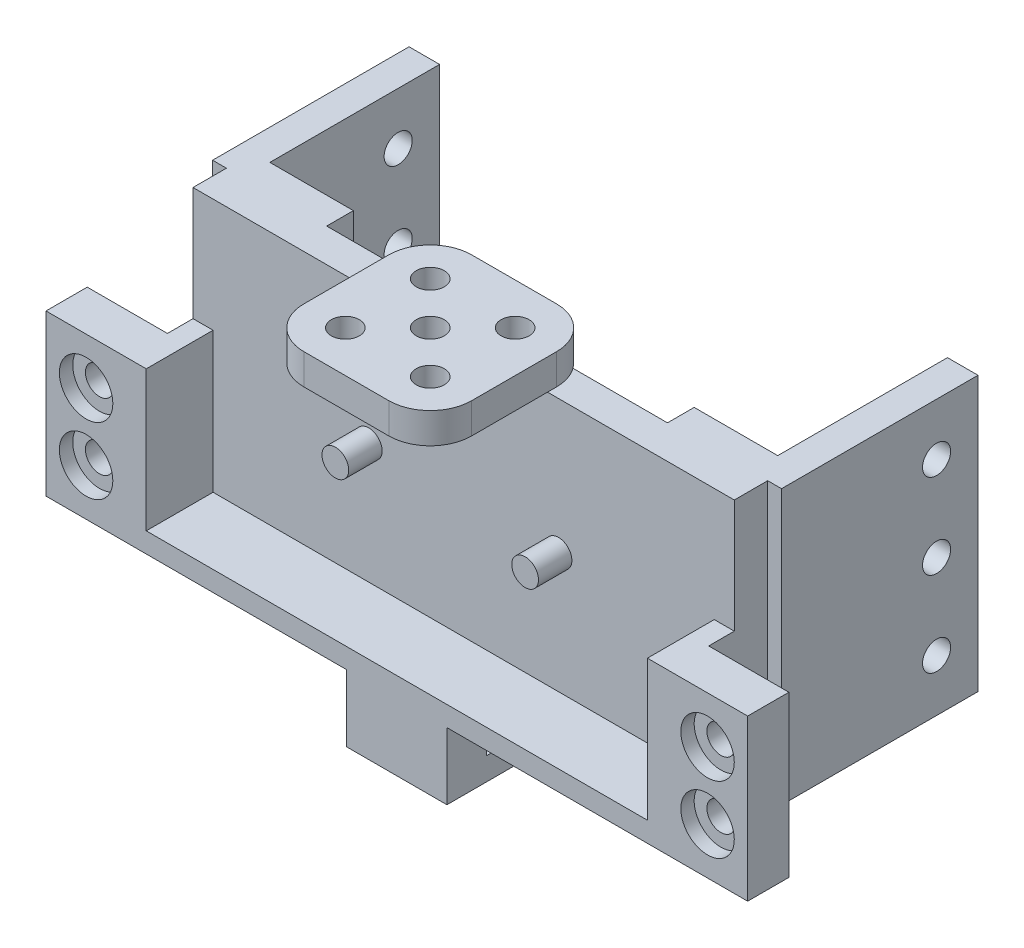
from build123d import *

# Parameters (mm, degrees)
SKETCH1_W                = 75
SKETCH1_H                = 35
BOSS_EXTRUDE1_DEPTH      = 5
SKETCH2_R                = 2
BOSS_EXTRUDE2_DEPTH      = 10
SKETCH3_W                = 75
SKETCH3_H                = 35
BOSS_EXTRUDE3_DEPTH      = 15
CUT_EXTRUDE2_DEPTH       = 10
SKETCH8_W                = 12.55
SKETCH8_H                = 5
SKETCH8_H_2              = 2.55
BOSS_EXTRUDE6_DEPTH      = 4.57
SKETCH9_R                = 2.1
CUT_EXTRUDE3_DEPTH       = 4.57
SKETCH14_W               = 3
SKETCH14_H               = 10
CUT_EXTRUDE5_DEPTH       = 17
SKETCH15_R               = 2.75
CUT_EXTRUDE6_DEPTH       = 1.5
FILLET1_R                = 1
CUT_EXTRUDE7_START       = -5
SKETCH19_R               = 2
CUT_EXTRUDE7_DEPTH       = 5
SKETCH20_W               = 6.17
SKETCH20_H               = 24
BOSS_EXTRUDE7_DEPTH      = 12
SKETCH21_W               = 6.17
SKETCH21_H               = 24
BOSS_EXTRUDE8_DEPTH      = 12
SKETCH24_R               = 2.1
CUT_EXTRUDE8_DEPTH       = 60.774520492
SKETCH25_R               = 4
CUT_EXTRUDE9_DEPTH       = 2
BOSS_EXTRUDE10_DEPTH     = 41
CUT_EXTRUDE11_DEPTH      = 99.402819573
CUT_EXTRUDE11_DEPTH_BACK = 99.402819573
SKETCH30_R               = 2.1
FILLET2_R                = 6.2
SKETCH31_W               = 15
SKETCH31_H               = 15
BOSS_EXTRUDE11_DEPTH     = 10
SKETCH32_W               = 5
SKETCH32_H               = 12
CUT_EXTRUDE12_DEPTH      = 10
SKETCH34_W               = 3.2
SKETCH34_H               = 3.2
CUT_EXTRUDE13_DEPTH      = 28
CUT_EXTRUDE14_START      = -5
SKETCH35_R               = 2
CUT_EXTRUDE14_DEPTH      = 5


with BuildPart() as part:
    # Sketch1 → Boss-Extrude1 (new body)
    with BuildSketch(Plane.XY):
        Rectangle(SKETCH1_W, SKETCH1_H)
    extrude(amount=BOSS_EXTRUDE1_DEPTH)

    # Sketch2 → Boss-Extrude2 (add)
    with BuildSketch(Plane.XY.offset(5)):
        with Locations(Location((-14.2, 0.5, 0), (0, 0, 180))):
            Circle(SKETCH2_R)
        with Locations(Location((14.2, 0.5, 0), (0, 0, 180))):
            Circle(SKETCH2_R)
    extrude(amount=BOSS_EXTRUDE2_DEPTH)

    # Sketch3 → Boss-Extrude3 (add)
    with BuildSketch(Plane(origin=(0, 0, 0), x_dir=(-1, 0, 0), z_dir=(0, 0, -1))):
        Polygon((40.5, 20.5), (-37.5, 20.5), (-40.5, 20.5), (-40.5, -20.5), (40.5, -20.5), (40.5, -17.5), align=None)
        Rectangle(SKETCH3_W, SKETCH3_H, mode=Mode.SUBTRACT)
    extrude(amount=-BOSS_EXTRUDE3_DEPTH)

    # Sketch4 → Cut-Extrude2 (cut)
    with BuildSketch(Plane(origin=(0, 20.5, 0), x_dir=(1, 0, 0), z_dir=(0, 1, 0))):
        Polygon((-37.5, -5), (-37.5, -12.5), (-37.5, -14), (-37.5, -15), (37.5, -15), (37.5, -14), (37.5, -12.5), (37.5, -5), align=None)
    extrude(amount=-CUT_EXTRUDE2_DEPTH, mode=Mode.SUBTRACT)

    # Sketch8 → Boss-Extrude6 (add)
    with BuildSketch(Plane(origin=(0, 20.5, 0), x_dir=(1, 0, 0), z_dir=(0, 1, 0))):
        Polygon((0, -15), (0, -5), (-12.55, -5), (-12.55, -22.55), (0, -22.55), align=None)
        Polygon((12.55, -5), (0, -5), (0, -15), (0, -22.55), (12.55, -22.55), align=None)
        with Locations((-6.275, -2.5)):
            Rectangle(SKETCH8_W, SKETCH8_H)
        with Locations((-6.275, 1.275)):
            Rectangle(SKETCH8_W, SKETCH8_H_2)
        with Locations((6.275, 1.275)):
            Rectangle(SKETCH8_W, SKETCH8_H_2)
        with Locations((6.275, -2.5)):
            Rectangle(SKETCH8_W, SKETCH8_H)
    extrude(amount=BOSS_EXTRUDE6_DEPTH)

    # Sketch9 → Cut-Extrude3 (cut)
    with BuildSketch(Plane(origin=(0, 25.07, 0), x_dir=(1, 0, 0), z_dir=(0, 1, 0))):
        with Locations(Location((0, -10, 0), (0, 0, 270))):
            Circle(SKETCH9_R)
        with Locations(Location((-6.349818895, -3.650181105, 0), (0, 0, 270))):
            Circle(SKETCH9_R)
        with Locations(Location((6.349818895, -3.650181105, 0), (0, 0, 270))):
            Circle(SKETCH9_R)
        with Locations(Location((6.349818895, -16.349818895, 0), (0, 0, 270))):
            Circle(SKETCH9_R)
        with Locations(Location((-6.349818895, -16.349818895, 0), (0, 0, 270))):
            Circle(SKETCH9_R)
    extrude(amount=-CUT_EXTRUDE3_DEPTH, mode=Mode.SUBTRACT)

    # Sketch14 → Cut-Extrude5 (cut)
    with BuildSketch(Plane(origin=(0, 20.5, 0), x_dir=(1, 0, 0), z_dir=(0, 1, 0))):
        with Locations((-39, -10)):
            Rectangle(SKETCH14_W, SKETCH14_H)
        with Locations((39, -10)):
            Rectangle(SKETCH14_W, SKETCH14_H)
    extrude(amount=-CUT_EXTRUDE5_DEPTH, mode=Mode.SUBTRACT)

    # Sketch15 → Cut-Extrude6 (cut)
    with BuildSketch(Plane(origin=(0, 20.5, 0), x_dir=(1, 0, 0), z_dir=(0, 1, 0))):
        with Locations((-6.349818895, -3.650181105)):
            Circle(SKETCH15_R)
        with Locations((6.349818895, -3.650181105)):
            Circle(SKETCH15_R)
    extrude(amount=-CUT_EXTRUDE6_DEPTH, mode=Mode.SUBTRACT)

    # Fillet1
    fillet1_edges = [part.edges().sort_by_distance(p)[0] for p in [
        (-8.745750645, 19.75, 5),
        (-3.953887145, 19.75, 5),
        (3.953887145, 19.75, 5),
        (8.745750645, 19.75, 5),
    ]]
    fillet(fillet1_edges, radius=FILLET1_R)

    # Sketch19 → Cut-Extrude7 (cut)
    with BuildSketch(Plane.XY.offset(15).offset(CUT_EXTRUDE7_START)):
        with Locations(Location((-14.2, 0.5, 0), (0, 0, 180))):
            Circle(SKETCH19_R)
    extrude(amount=CUT_EXTRUDE7_DEPTH, mode=Mode.SUBTRACT)

    # Sketch20 → Boss-Extrude7 (add)
    with BuildSketch(Plane(origin=(40.5, 0, 0), x_dir=(0, 0, -1), z_dir=(1, 0, 0))):
        with Locations((-11.915, -8.5)):
            Rectangle(SKETCH20_W, SKETCH20_H)
    extrude(amount=BOSS_EXTRUDE7_DEPTH)

    # Sketch21 → Boss-Extrude8 (add)
    with BuildSketch(Plane.ZY.offset(40.5)):
        with Locations((11.915, -8.5)):
            Rectangle(SKETCH21_W, SKETCH21_H)
    extrude(amount=BOSS_EXTRUDE8_DEPTH)

    # Sketch24 → Cut-Extrude8 (cut, through all)
    with BuildSketch(Plane(origin=(0, 0, 8.83), x_dir=(-1, 0, 0), z_dir=(0, 0, -1))):
        with Locations(Location((-46.5, -3.5, 0), (0, 0, 90))):
            Circle(SKETCH24_R)
        with Locations(Location((-46.5, -13.5, 0), (0, 0, 90))):
            Circle(SKETCH24_R)
        with Locations(Location((46.5, -3.5, 0), (0, 0, 90))):
            Circle(SKETCH24_R)
        with Locations(Location((46.5, -13.5, 0), (0, 0, 90))):
            Circle(SKETCH24_R)
    extrude(amount=-CUT_EXTRUDE8_DEPTH, mode=Mode.SUBTRACT)

    # Sketch25 → Cut-Extrude9 (cut)
    with BuildSketch(Plane.XY.offset(15)):
        with Locations((-46.5, -3.5)):
            Circle(SKETCH25_R)
        with Locations((-46.5, -13.5)):
            Circle(SKETCH25_R)
        with Locations((46.5, -13.5)):
            Circle(SKETCH25_R)
        with Locations((46.5, -3.5)):
            Circle(SKETCH25_R)
    extrude(amount=-CUT_EXTRUDE9_DEPTH, mode=Mode.SUBTRACT)

    # Sketch28 → Boss-Extrude10 (add)
    with BuildSketch(Plane.XZ.offset(20.5)):
        Polygon((-25.5, 0), (-42.57, 0), (-42.57, -29.4), (-38, -29.4), (-38, -4), (-25.5, -4), align=None)
        Polygon((25.5, 0), (42.57, 0), (42.57, -29.4), (38, -29.4), (38, -4), (25.5, -4), align=None)
    extrude(amount=-BOSS_EXTRUDE10_DEPTH)

    # Sketch30 → Cut-Extrude11 (cut, two sides: drawn at the far end of the back side and taken through both)
    with BuildSketch(Plane(origin=(-38, 0, 0), x_dir=(0, 0, -1), z_dir=(1, 0, 0)).offset(-CUT_EXTRUDE11_DEPTH_BACK)):
        with Locations(Location((23.2, 0, 0), (0, 0, 180))):
            Circle(SKETCH30_R)
        with Locations(Location((23.2, 12.7, 0), (0, 0, 180))):
            Circle(SKETCH30_R)
        with Locations(Location((23.2, -12.7, 0), (0, 0, 180))):
            Circle(SKETCH30_R)
    extrude(amount=CUT_EXTRUDE11_DEPTH + CUT_EXTRUDE11_DEPTH_BACK, mode=Mode.SUBTRACT)

    # Fillet2
    # the kernel refuses this fillet: 6.2 mm, written as the material it takes off along each edge
    with BuildSketch(Plane(origin=(12.55, 5, 22.55), x_dir=(0, 0, -1), z_dir=(0, 1, 0))) as fillet2_piece_1:
        with BuildLine():
            CenterArc((FILLET2_R, FILLET2_R), FILLET2_R, 180, 90)
            Line((0, FILLET2_R), (0, 0))
            Line((0, 0), (FILLET2_R, 0))
        make_face()
    extrude(amount=35.57, mode=Mode.SUBTRACT)
    with BuildSketch(Plane(origin=(12.55, 20.5, -2.55), x_dir=(0, 0, 1), z_dir=(0, 1, 0))) as fillet2_piece_2:
        with BuildLine():
            CenterArc((FILLET2_R, -FILLET2_R), FILLET2_R, 90, 90)
            Line((0, -FILLET2_R), (0, 0))
            Line((0, 0), (FILLET2_R, 0))
        make_face()
    extrude(amount=20.07, mode=Mode.SUBTRACT)
    with BuildSketch(Plane(origin=(-12.55, 20.5, -2.55), x_dir=(0, 0, 1), z_dir=(0, 1, 0))) as fillet2_piece_3:
        with BuildLine():
            CenterArc((FILLET2_R, FILLET2_R), FILLET2_R, 180, 90)
            Line((0, FILLET2_R), (0, 0))
            Line((0, 0), (FILLET2_R, 0))
        make_face()
    extrude(amount=20.07, mode=Mode.SUBTRACT)
    with BuildSketch(Plane(origin=(-12.55, 5, 22.55), x_dir=(0, 0, -1), z_dir=(0, 1, 0))) as fillet2_piece_4:
        with BuildLine():
            CenterArc((FILLET2_R, -FILLET2_R), FILLET2_R, 90, 90)
            Line((0, -FILLET2_R), (0, 0))
            Line((0, 0), (FILLET2_R, 0))
        make_face()
    extrude(amount=35.57, mode=Mode.SUBTRACT)

    # Sketch31 → Boss-Extrude11 (add)
    with BuildSketch(Plane.XZ.offset(20.5)):
        with Locations((0, 7.5)):
            Rectangle(SKETCH31_W, SKETCH31_H)
    extrude(amount=BOSS_EXTRUDE11_DEPTH)

    # Sketch32 → Cut-Extrude12 (cut)
    with BuildSketch(Plane.XZ.offset(30.5)):
        with Locations((0, 7.5)):
            Rectangle(SKETCH32_W, SKETCH32_H)
    extrude(amount=-CUT_EXTRUDE12_DEPTH, mode=Mode.SUBTRACT)

    # Sketch34 → Cut-Extrude13 (cut)
    with BuildSketch(Plane.ZY.offset(7.5)):
        with Locations((7.5, -25.5)):
            Rectangle(SKETCH34_W, SKETCH34_H)
    extrude(amount=-CUT_EXTRUDE13_DEPTH, mode=Mode.SUBTRACT)

    # Sketch35 → Cut-Extrude14 (cut)
    with BuildSketch(Plane.XY.offset(15).offset(CUT_EXTRUDE14_START)):
        with Locations(Location((14.2, 0.5, 0), (0, 0, 180))):
            Circle(SKETCH35_R)
    extrude(amount=CUT_EXTRUDE14_DEPTH, mode=Mode.SUBTRACT)


solid = part.part
